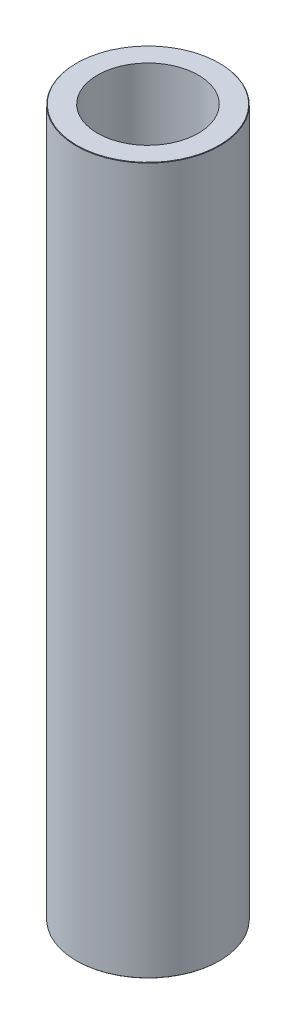
from build123d import *

# Parameters (mm, degrees)
SKETCH1_R           = 50
BOSS_EXTRUDE1_DEPTH = 493.005254962
SKETCH2_R           = 35.197503436
CUT_EXTRUDE1_DEPTH  = 499.050380404
CHAMFER1_SIZE       = 0.282193032


with BuildPart() as part:
    # Sketch1 → Boss-Extrude1 (new body)
    with BuildSketch(Plane(origin=(0, 0, 0), x_dir=(1, 0, 0), z_dir=(0, 1, 0))):
        Circle(SKETCH1_R)
    extrude(amount=BOSS_EXTRUDE1_DEPTH)

    # Sketch2 → Cut-Extrude1 (cut, through all)
    with BuildSketch(Plane(origin=(0, 0, 0), x_dir=(1, 0, 0), z_dir=(0, 1, 0))):
        Circle(SKETCH2_R)
    extrude(amount=CUT_EXTRUDE1_DEPTH, mode=Mode.SUBTRACT)

    # Chamfer1
    chamfer1_edges = [part.edges().sort_by_distance(p)[0] for p in [
        (-50, 493.005254962, 0),
        (-50, 0, 0),
    ]]
    chamfer(chamfer1_edges, length=CHAMFER1_SIZE)


solid = part.part
